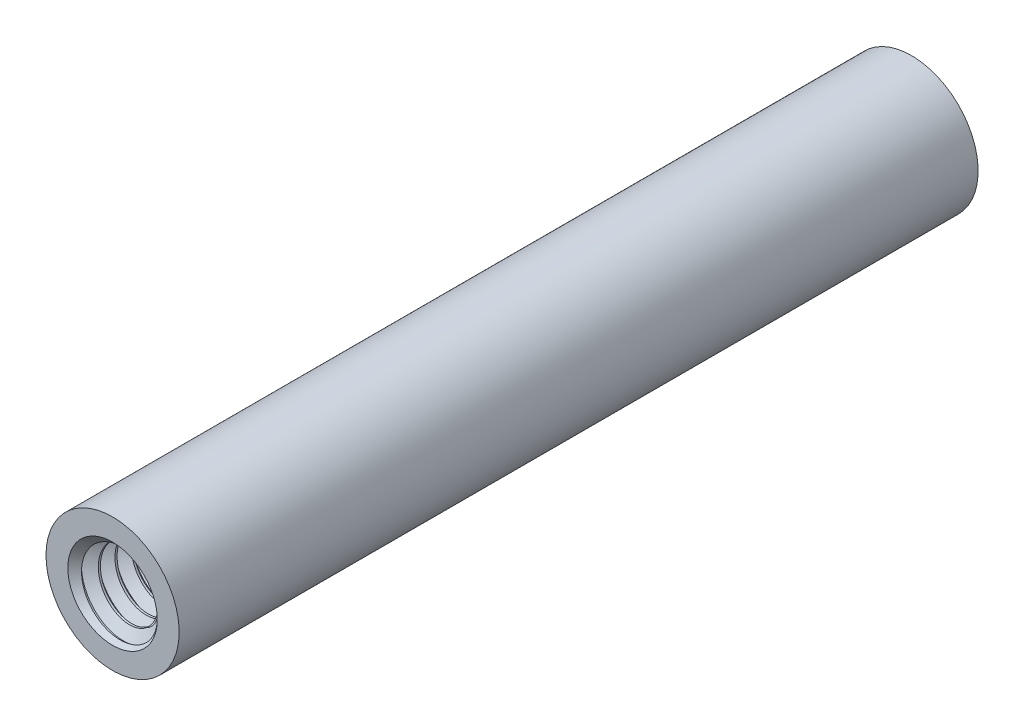
from build123d import *

# Parameters (mm, degrees)
EXTRUDE1_DEPTH      = 19.05
EXTRUDE1_DEPTH_BACK = 19.05
SKETCH1_R           = 3.175
SKETCH1_R_2         = 2.0828
SWEEP1_PITCH        = 0.79375
SKETCH6_R           = 3.175
EXTRUDE2_DEPTH      = 40.152247973
SKETCH9_W           = 15.875
SKETCH9_H           = 2.1336


with BuildPart() as part:
    # Sketch1 → Extrude1 (new, two sides: drawn at the far end of the back side and taken through both)
    with BuildSketch(Plane.XY.offset(-EXTRUDE1_DEPTH_BACK)):
        with Locations(Location((0, 0, 0), (0, 0, 180))):
            Circle(SKETCH1_R)
        with Locations(Location((0, 0, 0), (0, 0, 180))):
            Circle(SKETCH1_R_2, mode=Mode.SUBTRACT)
    extrude(amount=EXTRUDE1_DEPTH + EXTRUDE1_DEPTH_BACK)

    # Sweep1: arcs per turn and ends read off the stored shape
    # Sweep1: the profile of Sketch12 profile screwed along a right-hand helix through 49 turns, 8 arcs to a turn; built about Z, then put on its axis
    sweep1_z = Axis((0, 0, 0), (0, 0, 1))
    sweep1_corners = [(2.0831, 0, -0.694704455), (2.0831, 0, 0.000173205), (1.567244252, 0, -0.29765625), (1.567244252, 0, -0.396875)]
    with BuildLine(mode=Mode.PRIVATE) as sweep1_profile:
        Line(sweep1_corners[0], sweep1_corners[1])
        Line(sweep1_corners[1], sweep1_corners[2])
        Line(sweep1_corners[2], sweep1_corners[3])
        Line(sweep1_corners[3], sweep1_corners[0])
    sweep1_cap = Face(sweep1_profile.wire())
    sweep1_turn_angles = [0, 22.5, 45, 67.5, 90, 112.5, 135, 157.5, 180, 202.5, 225, 247.5, 270, 292.5, 315, 337.5, 360]
    sweep1_turn_weights = [1, 0.9238795325112867, 1, 0.9238795325112867, 1, 0.9238795325112867, 1, 0.9238795325112867, 1, 0.9238795325112867, 1, 0.9238795325112867, 1, 0.9238795325112867, 1, 0.9238795325112867, 1]
    sweep1_turn_rails = [Edge.make_bspline([Vector(p[0], p[1], 0).rotate(sweep1_z, sweep1_turn_angles[k]) / sweep1_turn_weights[k] + Vector(0, 0, p[2] + SWEEP1_PITCH * sweep1_turn_angles[k] / 360) for k in range(17)], [0, 0, 0, 1, 1, 2, 2, 3, 3, 4, 4, 5, 5, 6, 6, 7, 7, 8, 8, 8], 2, sweep1_turn_weights) for p in sweep1_corners]
    sweep1_turn_sides = [Face.make_surface_from_curves(sweep1_turn_rails[p[0]], sweep1_turn_rails[p[1]]) for p in [(0, 1), (1, 2), (2, 3), (3, 0)]]
    sweep1 = Plane(origin=(0, 0, -19.05), x_dir=(0, 1, 0), z_dir=(0, 0, 1)) * Solid(Shell([*[p.moved(Location((0, 0, SWEEP1_PITCH * i))) for i in range(49) for p in sweep1_turn_sides], sweep1_cap, sweep1_cap.rotate(sweep1_z, 17640).moved(Location((0, 0, SWEEP1_PITCH * 17640 / 360)))]))
    add(sweep1)

    # Sketch6 → Extrude2 (cut, through all)
    with BuildSketch(Plane(origin=(0, 0, -19.05), x_dir=(-1, 0, 0), z_dir=(0, 0, -1))):
        Circle(SKETCH6_R)
    extrude2 = extrude(amount=EXTRUDE2_DEPTH, mode=Mode.SUBTRACT)

    # Extrude3 cone 1 section (through the dimple's axis) → Extrude3 (revolve, cut)
    with BuildSketch(Plane(origin=(0, 0, -19.05), x_dir=(0, 1, 0), z_dir=(1, 0, 0))):
        Polygon((0, 0), (2.1336, 0), (0, 2.28800588), align=None)
    extrude3 = revolve(axis=Axis((0, 0, -19.05), (0, 0, 1)), mode=Mode.SUBTRACT)

    # Mirror1: Extrude2, Extrude3 across plane
    add(extrude2.mirror(Plane.XY), mode=Mode.SUBTRACT)
    add(extrude3.mirror(Plane.XY), mode=Mode.SUBTRACT)

    # Sketch9 → Revolve 2 (revolve)
    with BuildSketch(Plane(origin=(0, 0, 0), x_dir=(0, 0, -1), z_dir=(1, 0, 0)), mode=Mode.PRIVATE) as revolve_2_sk:
        with Locations((0, 1.0668)):
            Rectangle(SKETCH9_W, SKETCH9_H)
    revolve(revolve_2_sk.sketch.rotate(Axis((0, 0, 19.05), (0, 0, -1)), 270), axis=Axis((0, 0, 19.05), (0, 0, -1)))


solid = part.part
